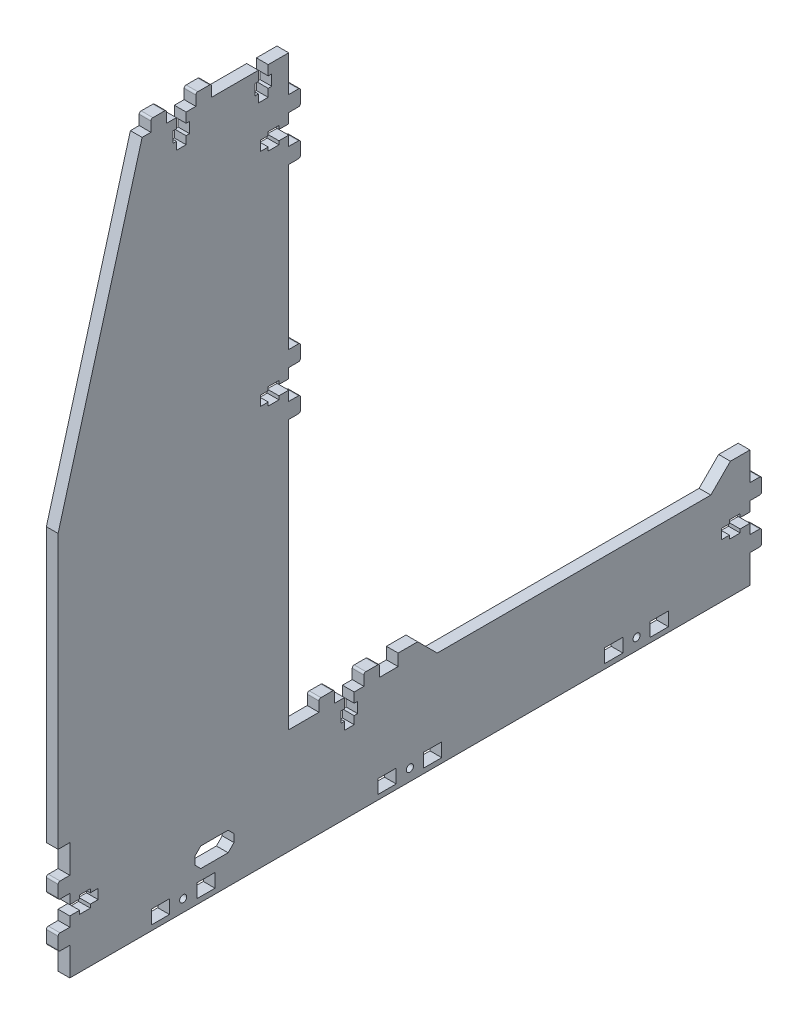
from build123d import *

# Parameters (mm, degrees)
ESQUISSE2_R             = 1.8
ESQUISSE2_W             = 9.3
ESQUISSE2_H             = 7
BOSS_EXTRU_1_DEPTH      = 3
BOSS_EXTRU_2_DEPTH      = 6
ENL_V_MAT_EXTRU_1_DEPTH = 6


with BuildPart() as part:
    # Esquisse2 → Boss.-Extru.1 (new, symmetric)
    with BuildSketch(Plane(origin=(0, 0, 0), x_dir=(0, 0, -1), z_dir=(1, 0, 0))):
        Polygon((-180, 200), (-180, 60), (-174, 60), (-174, 0), (174, 0), (174, 60), (164, 60), (154, 50), (14, 50), (4, 60), (-6, 60), (-6, 54), (-62, 54), (-62, 354), (-137, 354), align=None)
        with Locations((-116, 6.133618187)):
            Circle(ESQUISSE2_R, mode=Mode.SUBTRACT)
        with Locations((0, 6)):
            Circle(ESQUISSE2_R, mode=Mode.SUBTRACT)
        with Locations((116, 6)):
            Circle(ESQUISSE2_R, mode=Mode.SUBTRACT)
        with Locations((-127.65, 6.133618187)):
            Rectangle(ESQUISSE2_W, ESQUISSE2_H, mode=Mode.SUBTRACT)
        with Locations((-104.35, 6.133618187)):
            Rectangle(ESQUISSE2_W, ESQUISSE2_H, mode=Mode.SUBTRACT)
        with Locations((-11.65, 6)):
            Rectangle(ESQUISSE2_W, ESQUISSE2_H, mode=Mode.SUBTRACT)
        with Locations((11.65, 6)):
            Rectangle(ESQUISSE2_W, ESQUISSE2_H, mode=Mode.SUBTRACT)
        with Locations((104.35, 6)):
            Rectangle(ESQUISSE2_W, ESQUISSE2_H, mode=Mode.SUBTRACT)
        with Locations((127.65, 6)):
            Rectangle(ESQUISSE2_W, ESQUISSE2_H, mode=Mode.SUBTRACT)
    extrude(amount=BOSS_EXTRU_1_DEPTH, both=True)

    # Esquisse4 → Boss.-Extru.2 (add)
    with BuildSketch(Plane(origin=(3, 0, 0), x_dir=(0, 0, -1), z_dir=(1, 0, 0))):
        with BuildLine():
            Line((-179, 37.5), (-174, 37.5))
            Line((-174, 37.5), (-174, 45.5))
            Line((-174, 45.5), (-179, 45.5))
            ThreePointArc((-179, 45.5), (-179.707106781, 45.207106781), (-180, 44.5))
            Line((-180, 44.5), (-180, 38.5))
            ThreePointArc((-180, 38.5), (-179.707106781, 37.792893219), (-179, 37.5))
        make_face()
        with BuildLine():
            Line((-179, 14.5), (-174, 14.5))
            Line((-174, 14.5), (-174, 22.5))
            Line((-174, 22.5), (-179, 22.5))
            ThreePointArc((-179, 22.5), (-179.707106781, 22.207106781), (-180, 21.5))
            Line((-180, 21.5), (-180, 15.5))
            ThreePointArc((-180, 15.5), (-179.707106781, 14.792893219), (-179, 14.5))
        make_face()
        with BuildLine():
            Line((179, 22.5), (174, 22.5))
            Line((174, 22.5), (174, 14.5))
            Line((174, 14.5), (179, 14.5))
            ThreePointArc((179, 14.5), (179.707106781, 14.792893219), (180, 15.5))
            Line((180, 15.5), (180, 21.5))
            ThreePointArc((180, 21.5), (179.707106781, 22.207106781), (179, 22.5))
        make_face()
        with BuildLine():
            Line((179, 45.5), (174, 45.5))
            Line((174, 45.5), (174, 37.5))
            Line((174, 37.5), (179, 37.5))
            ThreePointArc((179, 37.5), (179.707106781, 37.792893219), (180, 38.5))
            Line((180, 38.5), (180, 44.5))
            ThreePointArc((180, 44.5), (179.707106781, 45.207106781), (179, 45.5))
        make_face()
        with BuildLine():
            Line((-23.5, 59), (-23.5, 54))
            Line((-23.5, 54), (-15.5, 54))
            Line((-15.5, 54), (-15.5, 59))
            ThreePointArc((-15.5, 59), (-15.792893219, 59.707106781), (-16.5, 60))
            Line((-16.5, 60), (-22.5, 60))
            ThreePointArc((-22.5, 60), (-23.207106781, 59.707106781), (-23.5, 59))
        make_face()
        with BuildLine():
            Line((-46.5, 59), (-46.5, 54))
            Line((-46.5, 54), (-38.5, 54))
            Line((-38.5, 54), (-38.5, 59))
            ThreePointArc((-38.5, 59), (-38.792893219, 59.707106781), (-39.5, 60))
            Line((-39.5, 60), (-45.5, 60))
            ThreePointArc((-45.5, 60), (-46.207106781, 59.707106781), (-46.5, 59))
        make_face()
        with BuildLine():
            Line((-57, 199.5), (-62, 199.5))
            Line((-62, 199.5), (-62, 191.5))
            Line((-62, 191.5), (-57, 191.5))
            ThreePointArc((-57, 191.5), (-56.292893219, 191.792893219), (-56, 192.5))
            Line((-56, 192.5), (-56, 198.5))
            ThreePointArc((-56, 198.5), (-56.292893219, 199.207106781), (-57, 199.5))
        make_face()
        with BuildLine():
            Line((-57, 222.5), (-62, 222.5))
            Line((-62, 222.5), (-62, 214.5))
            Line((-62, 214.5), (-57, 214.5))
            ThreePointArc((-57, 214.5), (-56.292893219, 214.792893219), (-56, 215.5))
            Line((-56, 215.5), (-56, 221.5))
            ThreePointArc((-56, 221.5), (-56.292893219, 222.207106781), (-57, 222.5))
        make_face()
        with BuildLine():
            Line((-57, 312.5), (-62, 312.5))
            Line((-62, 312.5), (-62, 304.5))
            Line((-62, 304.5), (-57, 304.5))
            ThreePointArc((-57, 304.5), (-56.292893219, 304.792893219), (-56, 305.5))
            Line((-56, 305.5), (-56, 311.5))
            ThreePointArc((-56, 311.5), (-56.292893219, 312.207106781), (-57, 312.5))
        make_face()
        with BuildLine():
            Line((-57, 335.5), (-62, 335.5))
            Line((-62, 335.5), (-62, 327.5))
            Line((-62, 327.5), (-57, 327.5))
            ThreePointArc((-57, 327.5), (-56.292893219, 327.792893219), (-56, 328.5))
            Line((-56, 328.5), (-56, 334.5))
            ThreePointArc((-56, 334.5), (-56.292893219, 335.207106781), (-57, 335.5))
        make_face()
        with BuildLine():
            Line((-109.5, 359), (-109.5, 354))
            Line((-109.5, 354), (-101.5, 354))
            Line((-101.5, 354), (-101.5, 359))
            ThreePointArc((-101.5, 359), (-101.792893219, 359.707106781), (-102.5, 360))
            Line((-102.5, 360), (-108.5, 360))
            ThreePointArc((-108.5, 360), (-109.207106781, 359.707106781), (-109.5, 359))
        make_face()
        with BuildLine():
            Line((-132.5, 359), (-132.5, 354))
            Line((-132.5, 354), (-124.5, 354))
            Line((-124.5, 354), (-124.5, 359))
            ThreePointArc((-124.5, 359), (-124.792893219, 359.707106781), (-125.5, 360))
            Line((-125.5, 360), (-131.5, 360))
            ThreePointArc((-131.5, 360), (-132.207106781, 359.707106781), (-132.5, 359))
        make_face()
    extrude(amount=-BOSS_EXTRU_2_DEPTH)

    # Esquisse4<3> → Enlèv. mat.-Extru.1 (cut)
    with BuildSketch(Plane(origin=(3, 0, 0), x_dir=(0, 0, -1), z_dir=(1, 0, 0))):
        Polygon((-174, 32.5), (-174, 27.5), (-169, 27.5), (-169, 25.7), (-163.5, 25.7), (-163.5, 27.5), (-159.5, 27.5), (-159.5, 32.5), (-163.5, 32.5), (-163.5, 34.3), (-169, 34.3), (-169, 32.5), align=None)
        Polygon((174, 27.5), (174, 32.5), (169, 32.5), (169, 34.3), (163.5, 34.3), (163.5, 32.5), (159.5, 32.5), (159.5, 27.5), (163.5, 27.5), (163.5, 25.7), (169, 25.7), (169, 27.5), align=None)
        Polygon((-28.5, 54), (-33.5, 54), (-33.5, 49), (-35.3, 49), (-35.3, 43.5), (-33.5, 43.5), (-33.5, 39.5), (-28.5, 39.5), (-28.5, 43.5), (-26.7, 43.5), (-26.7, 49), (-28.5, 49), align=None)
        Polygon((-62, 204.5), (-62, 209.5), (-67, 209.5), (-67, 211.3), (-72.5, 211.3), (-72.5, 209.5), (-76.5, 209.5), (-76.5, 204.5), (-72.5, 204.5), (-72.5, 202.7), (-67, 202.7), (-67, 204.5), align=None)
        Polygon((-62, 317.5), (-62, 322.5), (-67, 322.5), (-67, 324.3), (-72.5, 324.3), (-72.5, 322.5), (-76.5, 322.5), (-76.5, 317.5), (-72.5, 317.5), (-72.5, 315.7), (-67, 315.7), (-67, 317.5), align=None)
        Polygon((-72.5, 354), (-77.5, 354), (-77.5, 349), (-79.3, 349), (-79.3, 343.5), (-77.5, 343.5), (-77.5, 339.5), (-72.5, 339.5), (-72.5, 343.5), (-70.7, 343.5), (-70.7, 349), (-72.5, 349), align=None)
        Polygon((-114.5, 354), (-119.5, 354), (-119.5, 349), (-121.3, 349), (-121.3, 343.5), (-119.5, 343.5), (-119.5, 339.5), (-114.5, 339.5), (-114.5, 343.5), (-112.7, 343.5), (-112.7, 349), (-114.5, 349), align=None)
        Polygon((-107, 25), (-110, 22), (-110, 18), (-107, 15), (-93, 15), (-90, 18), (-90, 22), (-93, 25), align=None)
    extrude(amount=-ENL_V_MAT_EXTRU_1_DEPTH, mode=Mode.SUBTRACT)


solid = part.part
